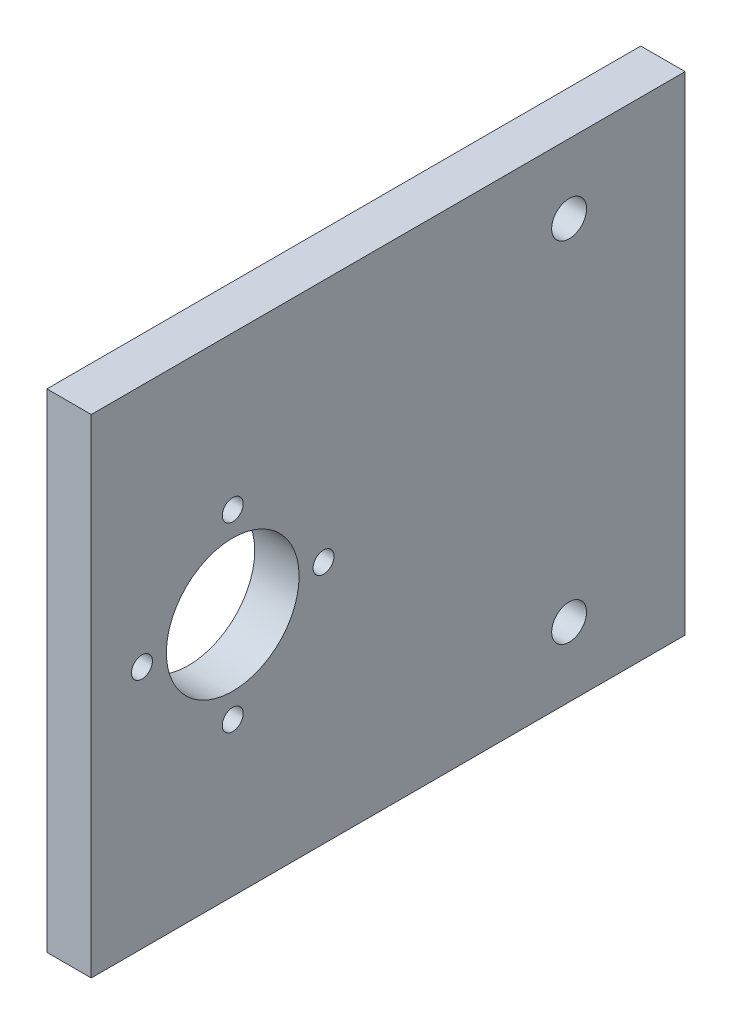
from build123d import *

# Parameters (mm, degrees)
SKETCH1_W           = 69.85
SKETCH1_H           = 85
SKETCH1_R           = 1.5
SKETCH1_R_2         = 9.5
SKETCH1_R_3         = 2.5
BOSS_EXTRUDE1_DEPTH = 6.35


with BuildPart() as part:
    # Sketch1 → Boss-Extrude1 (new body)
    with BuildSketch(Plane.YZ):
        Rectangle(SKETCH1_W, SKETCH1_H)
        with Locations((0, 35.25)):
            Circle(SKETCH1_R, mode=Mode.SUBTRACT)
        with Locations((0, 9.25)):
            Circle(SKETCH1_R, mode=Mode.SUBTRACT)
        with Locations((-13, 22.25)):
            Circle(SKETCH1_R, mode=Mode.SUBTRACT)
        with Locations((13, 22.25)):
            Circle(SKETCH1_R, mode=Mode.SUBTRACT)
        with Locations((0, 22.25)):
            Circle(SKETCH1_R_2, mode=Mode.SUBTRACT)
        with Locations((-25, -25.9)):
            Circle(SKETCH1_R_3, mode=Mode.SUBTRACT)
        with Locations((25, -25.9)):
            Circle(SKETCH1_R_3, mode=Mode.SUBTRACT)
    extrude(amount=BOSS_EXTRUDE1_DEPTH)


solid = part.part
